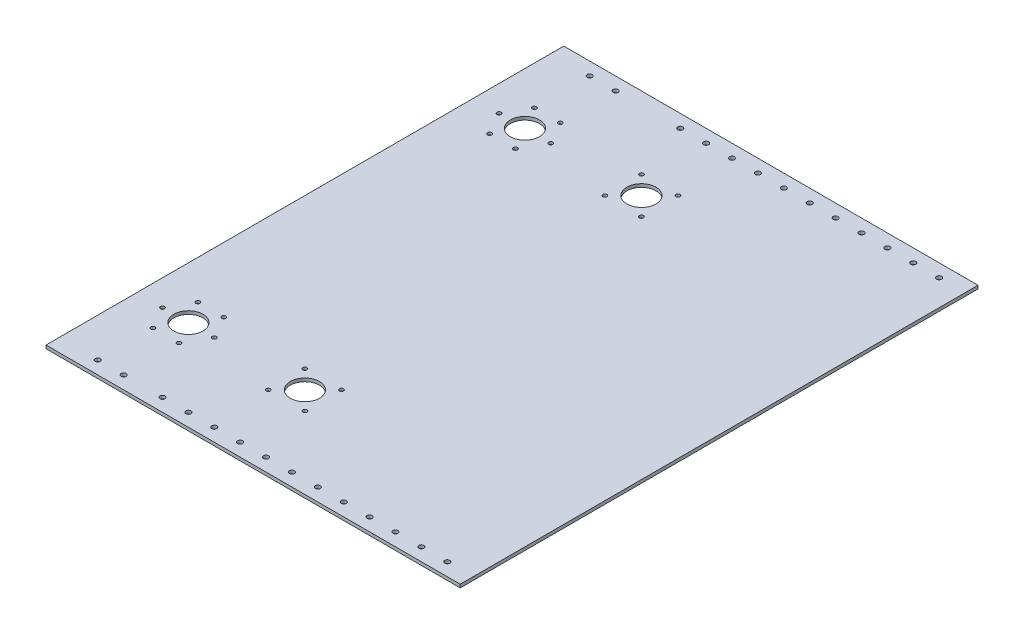
from build123d import *

# Parameters (mm, degrees)
SKETCH1_W               = 406.4
SKETCH1_H               = 508
BOSS_EXTRUDE1_DEPTH     = 3.175
SKETCH2_R               = 14.2875
CUT_EXTRUDE1_DEPTH      = 3.175
CUT_EXTRUDE2_DEPTH      = 651.56517016
CUT_EXTRUDE2_DEPTH_BACK = 651.56517016
SKETCH3_R               = 2.4892
SKETCH4_R               = 2.0193
CUT_EXTRUDE3_DEPTH      = 2.54


with BuildPart() as part:
    # Sketch1 → Boss-Extrude1 (new body)
    with BuildSketch(Plane(origin=(0, 0, 0), x_dir=(1, 0, 0), z_dir=(0, 1, 0))):
        with Locations((203.2, 254)):
            Rectangle(SKETCH1_W, SKETCH1_H)
    extrude(amount=BOSS_EXTRUDE1_DEPTH)

    # Sketch2 → Cut-Extrude1 (cut)
    with BuildSketch(Plane(origin=(0, 3.175, 0), x_dir=(1, 0, 0), z_dir=(0, 1, 0))):
        with Locations((50.8, 419.1)):
            Circle(SKETCH2_R)
        with Locations((165.1, 419.1)):
            Circle(SKETCH2_R)
        with Locations((50.8, 88.9)):
            Circle(SKETCH2_R)
        with Locations((165.1, 88.9)):
            Circle(SKETCH2_R)
    extrude(amount=-CUT_EXTRUDE1_DEPTH, mode=Mode.SUBTRACT)

    # Sketch3 → Cut-Extrude2 (cut, two sides: drawn at the far end of the back side and taken through both)
    with BuildSketch(Plane(origin=(0, 3.175, 0), x_dir=(1, 0, 0), z_dir=(0, 1, 0)).offset(-CUT_EXTRUDE2_DEPTH_BACK)):
        with Locations((38.1, 12.7)):
            Circle(SKETCH3_R)
        with Locations((63.5, 12.7)):
            Circle(SKETCH3_R)
        with Locations((127, 12.7)):
            Circle(SKETCH3_R)
        with Locations((152.4, 12.7)):
            Circle(SKETCH3_R)
        with Locations((177.8, 12.7)):
            Circle(SKETCH3_R)
        with Locations((203.2, 12.7)):
            Circle(SKETCH3_R)
        with Locations((228.6, 12.7)):
            Circle(SKETCH3_R)
        with Locations((254, 12.7)):
            Circle(SKETCH3_R)
        with Locations((279.4, 12.7)):
            Circle(SKETCH3_R)
        with Locations((304.8, 12.7)):
            Circle(SKETCH3_R)
        with Locations((330.2, 12.7)):
            Circle(SKETCH3_R)
        with Locations((355.6, 12.7)):
            Circle(SKETCH3_R)
        with Locations((381, 12.7)):
            Circle(SKETCH3_R)
        with Locations((381, 495.3)):
            Circle(SKETCH3_R)
        with Locations((355.6, 495.3)):
            Circle(SKETCH3_R)
        with Locations((330.2, 495.3)):
            Circle(SKETCH3_R)
        with Locations((304.8, 495.3)):
            Circle(SKETCH3_R)
        with Locations((279.4, 495.3)):
            Circle(SKETCH3_R)
        with Locations((254, 495.3)):
            Circle(SKETCH3_R)
        with Locations((228.6, 495.3)):
            Circle(SKETCH3_R)
        with Locations((203.2, 495.3)):
            Circle(SKETCH3_R)
        with Locations((177.8, 495.3)):
            Circle(SKETCH3_R)
        with Locations((152.4, 495.3)):
            Circle(SKETCH3_R)
        with Locations((127, 495.3)):
            Circle(SKETCH3_R)
        with Locations((63.5, 495.3)):
            Circle(SKETCH3_R)
        with Locations((38.1, 495.3)):
            Circle(SKETCH3_R)
        with Locations((101.6, 12.7)):
            Circle(SKETCH3_R)
    extrude(amount=CUT_EXTRUDE2_DEPTH + CUT_EXTRUDE2_DEPTH_BACK, mode=Mode.SUBTRACT)

    # Sketch4 → Cut-Extrude3 (cut)
    with BuildSketch(Plane(origin=(0, 3.175, 0), x_dir=(1, 0, 0), z_dir=(0, 1, 0))):
        with Locations((76.2, 419.1)):
            Circle(SKETCH4_R)
        with Locations((25.4, 419.1)):
            Circle(SKETCH4_R)
        with Locations((38.1, 441.097045256)):
            Circle(SKETCH4_R)
        with Locations((63.5, 441.097045256)):
            Circle(SKETCH4_R)
        with Locations((63.5, 397.102954744)):
            Circle(SKETCH4_R)
        with Locations((38.1, 397.102954744)):
            Circle(SKETCH4_R)
        with Locations((147.139487788, 437.060512212)):
            Circle(SKETCH4_R)
        with Locations((183.060512212, 437.060512212)):
            Circle(SKETCH4_R)
        with Locations((183.060512212, 401.139487788)):
            Circle(SKETCH4_R)
        with Locations((147.139487788, 401.139487788)):
            Circle(SKETCH4_R)
        with Locations((147.139487788, 106.860512212)):
            Circle(SKETCH4_R)
        with Locations((183.060512212, 106.860512212)):
            Circle(SKETCH4_R)
        with Locations((183.060512212, 70.939487788)):
            Circle(SKETCH4_R)
        with Locations((147.139487788, 70.939487788)):
            Circle(SKETCH4_R)
        with Locations((38.1, 110.897045256)):
            Circle(SKETCH4_R)
        with Locations((63.5, 110.897045256)):
            Circle(SKETCH4_R)
        with Locations((63.5, 66.902954744)):
            Circle(SKETCH4_R)
        with Locations((38.1, 66.902954744)):
            Circle(SKETCH4_R)
        with Locations((25.4, 88.9)):
            Circle(SKETCH4_R)
        with Locations((76.2, 88.9)):
            Circle(SKETCH4_R)
    extrude(amount=-CUT_EXTRUDE3_DEPTH, mode=Mode.SUBTRACT)


solid = part.part
